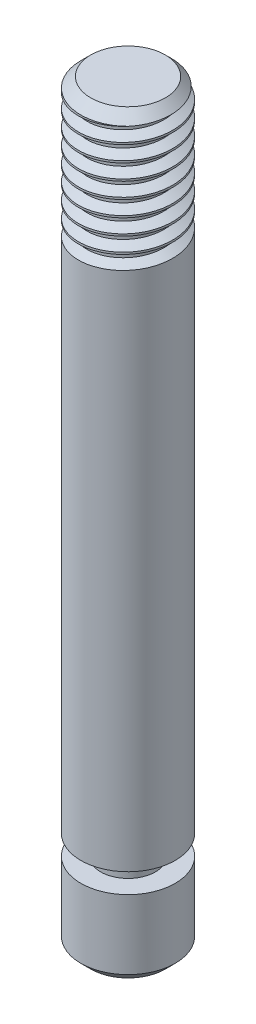
from build123d import *

# Parameters (mm, degrees)
SKETCH1_R           = 2.38125
BOSS_EXTRUDE1_DEPTH = 38.1
CHAMFER1_SIZE       = 0.5
THREAD1_PITCH       = 0.8
SKETCH17_W          = 1
SKETCH17_H          = 1


with BuildPart() as part:
    # Sketch1 → Boss-Extrude1 (new body)
    with BuildSketch(Plane(origin=(0, 0, 0), x_dir=(1, 0, 0), z_dir=(0, 1, 0))):
        with Locations(Location((0, 0, 0), (0, 0, 270))):
            Circle(SKETCH1_R)
    extrude(amount=BOSS_EXTRUDE1_DEPTH)

    # Chamfer1
    chamfer1_edges = [part.edges().sort_by_distance(p)[0] for p in [
        (0, 0, -2.38125),
        (0, 38.1, -2.38125),
    ]]
    chamfer(chamfer1_edges, length=CHAMFER1_SIZE)

    # Thread1: the profile of Thread Profile1 profile screwed along a right-hand helix of 7.9375 turns, 8 arcs to a turn; built about Z, then put on its axis
    thread1_z = Axis((0, 0, 0), (0, 0, 1))
    thread1_corners = [(2.38155, 0, -0.000173205), (2.38155, 0, 0.700173203), (1.9482373, 0, 0.449999999), (1.9482373, 0, 0.249999999)]
    with BuildLine(mode=Mode.PRIVATE) as thread1_profile:
        Line(thread1_corners[0], thread1_corners[1])
        Line(thread1_corners[1], thread1_corners[2])
        Line(thread1_corners[2], thread1_corners[3])
        Line(thread1_corners[3], thread1_corners[0])
    thread1_cap = Face(thread1_profile.wire())
    thread1_turn_angles = [0, 22.5, 45, 67.5, 90, 112.5, 135, 157.5, 180, 202.5, 225, 247.5, 270, 292.5, 315, 337.5, 360]
    thread1_turn_weights = [1, 0.9238795325112867, 1, 0.9238795325112867, 1, 0.9238795325112867, 1, 0.9238795325112867, 1, 0.9238795325112867, 1, 0.9238795325112867, 1, 0.9238795325112867, 1, 0.9238795325112867, 1]
    thread1_turn_rails = [Edge.make_bspline([Vector(p[0], p[1], 0).rotate(thread1_z, thread1_turn_angles[k]) / thread1_turn_weights[k] + Vector(0, 0, p[2] + THREAD1_PITCH * thread1_turn_angles[k] / 360) for k in range(17)], [0, 0, 0, 1, 1, 2, 2, 3, 3, 4, 4, 5, 5, 6, 6, 7, 7, 8, 8, 8], 2, thread1_turn_weights) for p in thread1_corners]
    thread1_turn_sides = [Face.make_surface_from_curves(thread1_turn_rails[p[0]], thread1_turn_rails[p[1]]) for p in [(0, 1), (1, 2), (2, 3), (3, 0)]]
    thread1_last_angles = [2520, 2542.5, 2565, 2587.5, 2610, 2632.5, 2655, 2677.5, 2700, 2722.5, 2745, 2767.5, 2790, 2812.5, 2835, 2846.25, 2857.5]
    thread1_last_weights = [1, 0.9238795325112867, 1, 0.9238795325112867, 1, 0.9238795325112867, 1, 0.9238795325112867, 1, 0.9238795325112867, 1, 0.9238795325112867, 1, 0.9238795325112867, 1, 0.9807852804032304, 1]
    thread1_last_rails = [Edge.make_bspline([Vector(p[0], p[1], 0).rotate(thread1_z, thread1_last_angles[k]) / thread1_last_weights[k] + Vector(0, 0, p[2] + THREAD1_PITCH * thread1_last_angles[k] / 360) for k in range(17)], [0, 0, 0, 1, 1, 2, 2, 3, 3, 4, 4, 5, 5, 6, 6, 7, 7, 8, 8, 8], 2, thread1_last_weights) for p in thread1_corners]
    thread1_last_sides = [Face.make_surface_from_curves(thread1_last_rails[p[0]], thread1_last_rails[p[1]]) for p in [(0, 1), (1, 2), (2, 3), (3, 0)]]
    thread1 = Plane(origin=(0, 38.1, 0), x_dir=(-1, 0, 0), z_dir=(0, -1, 0)) * Solid(Shell([*[p.moved(Location((0, 0, THREAD1_PITCH * i))) for i in range(7) for p in thread1_turn_sides], *thread1_last_sides, thread1_cap, thread1_cap.rotate(thread1_z, 2857.5).moved(Location((0, 0, THREAD1_PITCH * 2857.5 / 360)))]))
    add(thread1, mode=Mode.SUBTRACT)

    # Sketch17 → Cut-Revolve1 (revolve, cut)
    with BuildSketch(Plane.XY, mode=Mode.PRIVATE) as cut_revolve1_sk:
        with Locations((-1.88125, 4.5)):
            Rectangle(SKETCH17_W, SKETCH17_H)
    revolve(cut_revolve1_sk.sketch.rotate(Axis((0, 0, 0), (0, 1, 0)), 270), axis=Axis((0, 0, 0), (0, 1, 0)), mode=Mode.SUBTRACT)


solid = part.part
